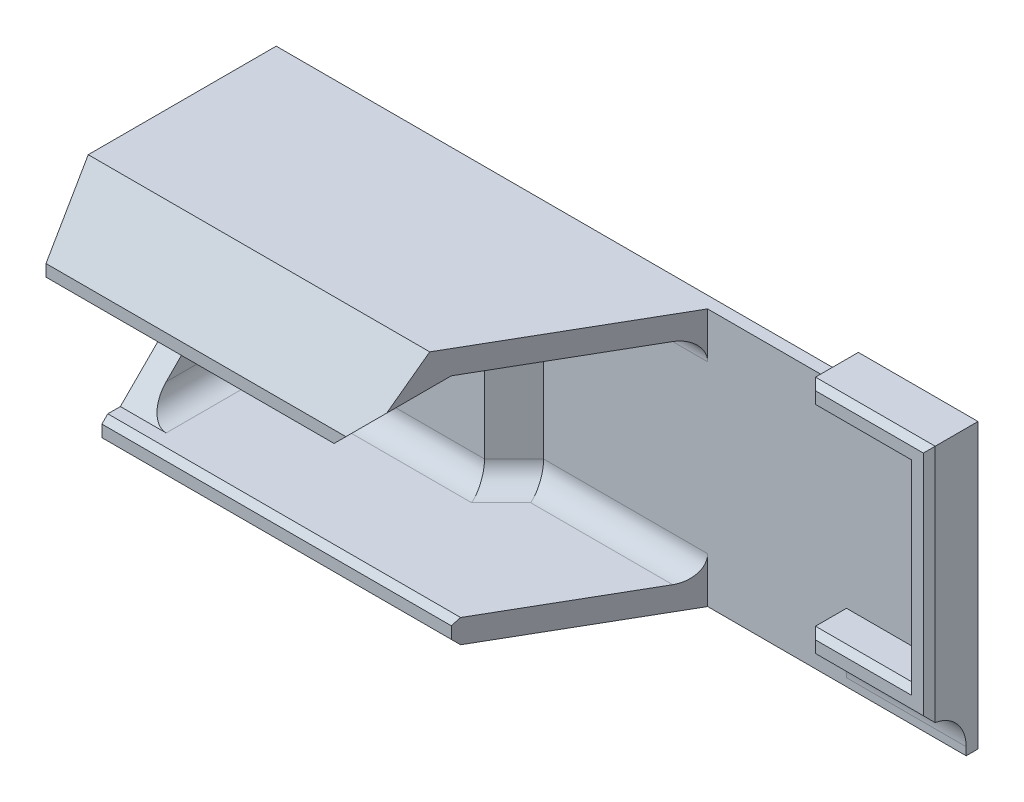
from build123d import *

# Parameters (mm, degrees)
BOSS_EXTRUDE1_DEPTH             = 60
BOSS_EXTRUDE2_DEPTH             = 35
CUT_EXTRUDE1_DEPTH              = 103.668316888
CUT_EXTRUDE2_DEPTH              = 113.568195388
CUT_EXTRUDE3_DEPTH              = 112.060037393
BOSS_EXTRUDE3_DEPTH             = 5
BOSS_EXTRUDE3_DIRECTION_2_REACH = 115.625
BOSS_EXTRUDE4_DEPTH             = 3.2
BOSS_EXTRUDE5_DEPTH             = 28.5
BOSS_EXTRUDE6_DEPTH             = 3.2
SKETCH8_W                       = 25.2
SKETCH8_H                       = 32.67766953
CUT_EXTRUDE4_DEPTH              = 111.954500313
CHAMFER1_SIZE                   = 0.8
FILLET1_R                       = 5
FILLET2_R                       = 3
FILLET3_R                       = 3
CHAMFER2_SIZE                   = 1.6
CHAMFER3_SIZE                   = 0.8


with BuildPart() as part:
    # Sketch1 → Boss-Extrude1 (new body)
    with BuildSketch(Plane(origin=(0, 0, 0), x_dir=(0, 0, -1), z_dir=(1, 0, 0))):
        Polygon((-9, 9.5), (13, 9.5), (13, -19), (-9, -19), (-9, -22.2), (13, -22.2), (13, -37.2), (-3.07766953, -53.27766953), (-1.47766953, -54.87766953), (16.2, -37.2), (16.2, 12.7), (-10.847520861, 12.7), (-17.256108849, 1.6), (-14.484827557, 0), align=None)
    extrude(amount=BOSS_EXTRUDE1_DEPTH)

    # Sketch2 → Boss-Extrude2 (add)
    with BuildSketch(Plane(origin=(60, 0, 0), x_dir=(0, 0, -1), z_dir=(1, 0, 0))):
        Polygon((-3.07766953, -53.27766953), (-1.47766953, -54.87766953), (16.2, -37.2), (16.2, 12.7), (13, 12.7), (13, -37.2), align=None)
    extrude(amount=BOSS_EXTRUDE2_DEPTH)

    # Sketch3 → Cut-Extrude1 (cut, through all)
    with BuildSketch(Plane.XZ.offset(22.2)):
        Polygon((60, -13), (42.531627411, 17.256108849), (60, 17.256108849), align=None)
    extrude(amount=-CUT_EXTRUDE1_DEPTH, mode=Mode.SUBTRACT)

    # Sketch4 → Cut-Extrude2 (cut, through all)
    with BuildSketch(Plane.XY.offset(9)):
        Polygon((47.298294078, 9.5), (37.798294078, 0), (47.298294078, 0), align=None)
    extrude(amount=CUT_EXTRUDE2_DEPTH, mode=Mode.SUBTRACT)

    # Sketch5 → Cut-Extrude3 (cut, through all)
    with BuildSketch(Plane.ZY):
        Polygon((16.563288526, 2.8), (16.563288526, 1.2), (17.256108849, 1.6), align=None)
        Polygon((2.27766953, -52.47766953), (2.27766953, -54.07766953), (3.07766953, -53.27766953), align=None)
    extrude(amount=-CUT_EXTRUDE3_DEPTH, mode=Mode.SUBTRACT)

    # Sketch6 → Boss-Extrude3 (add)
    with BuildSketch(Plane.XY.offset(-13)):
        Polygon((78.8, 13), (91.8, 13), (91.8, -13), (78.8, -13), (78.8, -16.2), (95, -16.2), (95, 16.2), (78.8, 16.2), align=None)
    extrude(amount=BOSS_EXTRUDE3_DEPTH)

    # Boss-Extrude3 direction 2: up to this face of the body (flat: up to its plane)
    boss_extrude3_direction_2_end = Plane(part.part.faces().sort_by_distance((47.5, -12.25, -16.2))[0])
    # Sketch6 → Boss-Extrude3 direction 2 (add, up to the picked face)
    with BuildSketch(Plane.XY.offset(-13), mode=Mode.PRIVATE) as boss_extrude3_direction_2_sk1:
        Polygon((78.8, 13), (91.8, 13), (91.8, -13), (78.8, -13), (78.8, -16.2), (95, -16.2), (95, 16.2), (78.8, 16.2), align=None)
    boss_extrude3_direction_2_tool1 = split(extrude(boss_extrude3_direction_2_sk1.sketch, amount=-BOSS_EXTRUDE3_DIRECTION_2_REACH, mode=Mode.PRIVATE), bisect_by=boss_extrude3_direction_2_end, keep=Keep.BOTH, mode=Mode.PRIVATE)
    add(boss_extrude3_direction_2_tool1.solids().sort_by(Axis((85.3, 13.362243, -13), (0, 0, -1)))[0])

    # Sketch7 → Boss-Extrude4 (add)
    with BuildSketch(Plane(origin=(0, 0, -16.2), x_dir=(-1, 0, 0), z_dir=(0, 0, -1))):
        Polygon((-95, 16.2), (-78.8, 16.2), (-75.3, 12.7), (-95, 12.7), align=None)
    extrude(amount=-BOSS_EXTRUDE4_DEPTH)

    # Sketch9 → Boss-Extrude5 (add)
    with BuildSketch(Plane(origin=(0, -19, 0), x_dir=(1, 0, 0), z_dir=(0, 1, 0))):
        Polygon((33.798294078, 9), (37.798294078, 13), (0, 13), (0, 9), align=None)
    extrude(amount=BOSS_EXTRUDE5_DEPTH)

    # Sketch10 → Boss-Extrude6 (add)
    with BuildSketch(Plane.ZY):
        Polygon((6.5, -19), (-3, -9.5), (-9, -9.5), (-9, -19), align=None)
    extrude(amount=-BOSS_EXTRUDE6_DEPTH)

    # Sketch8 → Cut-Extrude4 (cut, through all)
    with BuildSketch(Plane.ZY):
        with Locations((-3.6, -38.538834765)):
            Rectangle(SKETCH8_W, SKETCH8_H)
    extrude(amount=-CUT_EXTRUDE4_DEPTH, mode=Mode.SUBTRACT)

    # Chamfer1
    chamfer1_edges = [part.edges().sort_by_distance(p)[0] for p in [
        (78.8, 14.6, -8),
        (85.3, 13, -8),
        (91.8, 0, -8),
        (85.3, -13, -8),
        (78.8, -14.6, -8),
        (86.9, -16.2, -8),
        (95, 0, -8),
        (86.9, 16.2, -8),
    ]]
    chamfer(chamfer1_edges, length=CHAMFER1_SIZE)

    # Fillet1
    # the kernel refuses this fillet: 5 mm, written as the material it adds along each edge
    with BuildSketch(Plane(origin=(78.8, -16.2, -13), x_dir=(0, 0, 1), z_dir=(1, 0, 0))) as fillet1_piece_1:
        with BuildLine():
            CenterArc((5, 4.935585072), FILLET1_R, 180, 80.793103779)
            Line((0, 4.935585072), (0, 0))
            Line((0, 0), (4.2, 0))
        make_face()
    extrude(amount=16.2)

    # Fillet2
    fillet2_edges = [part.edges().sort_by_distance(p)[0] for p in [
        (35.798294078, -19, -11),
        (16.899147039, 9.5, -9),
        (35.798294078, 9.5, -11),
        (18.499147039, -19, -9),
        (1.6, -9.5, -9),
        (48.899147039, 9.5, -13),
        (48.899147039, -19, -13),
    ]]
    fillet(fillet2_edges, radius=FILLET2_R)

    # Fillet3
    fillet3_edges = [part.edges().sort_by_distance(p)[0] for p in [
        (3.2, -19, 0.25),
        (3.2, -11.25, -9),
        (3.2, -18.121320344, -8.121320344),
    ]]
    fillet(fillet3_edges, radius=FILLET3_R)

    # Chamfer2
    chamfer2_edges = [part.edges().sort_by_distance(p)[0] for p in [
        (86.9, 16.2, -16.2),
        (37.65, 12.7, -16.2),
        (77.05, 14.45, -16.2),
        (95, -3, -16.2),
        (0, -4.75, -16.2),
        (47.5, -22.2, -16.2),
    ]]
    chamfer(chamfer2_edges, length=CHAMFER2_SIZE)

    # Chamfer3
    chamfer3_edges = [part.edges().sort_by_distance(p)[0] for p in [
        (23.649147039, -22.2, 9),
        (23.649147039, -19, 9),
    ]]
    chamfer(chamfer3_edges, length=CHAMFER3_SIZE)


solid = part.part
